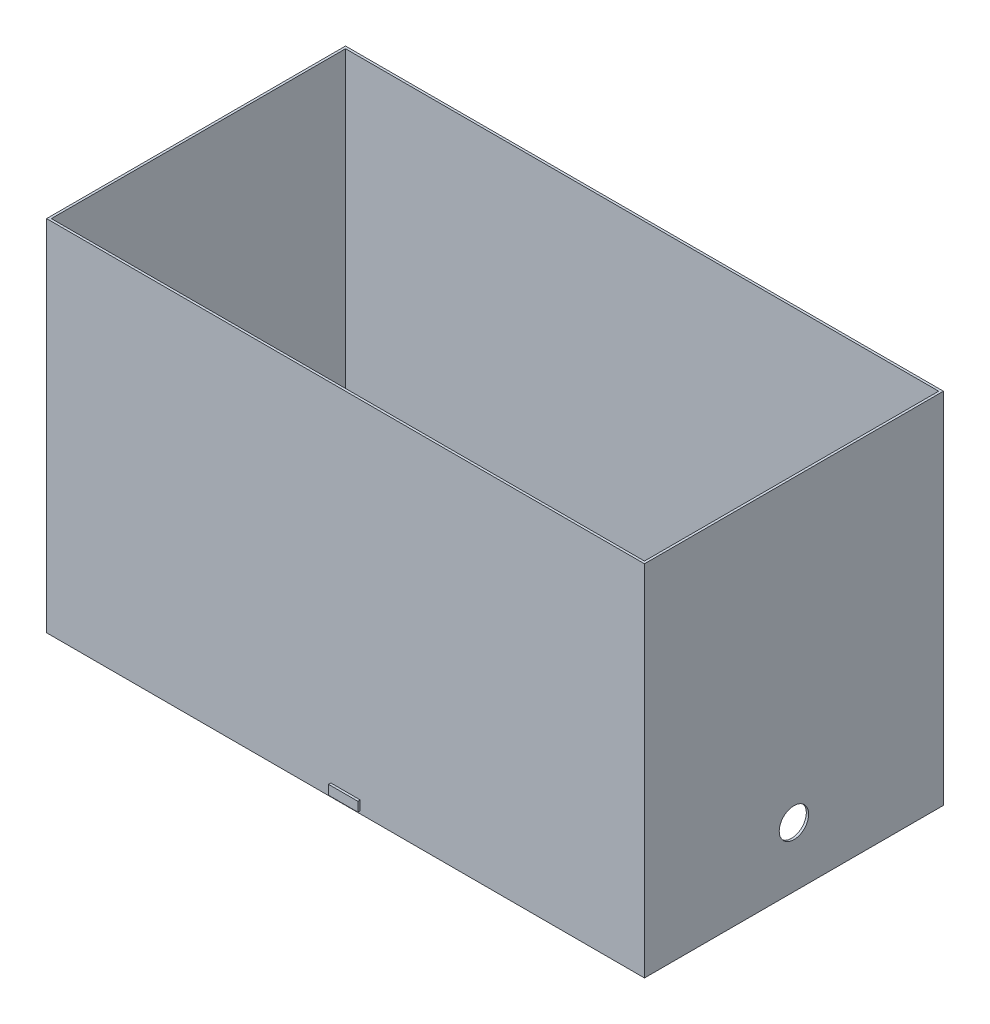
from build123d import *

# Parameters (mm, degrees)
SKETCH1_W           = 508
SKETCH1_H           = 254
SKETCH1_W_2         = 504
SKETCH1_H_2         = 250
BOSS_EXTRUDE1_DEPTH = 304.8
SKETCH2_R           = 12.5
CUT_EXTRUDE1_DEPTH  = 606.884510447
SKETCH3_W           = 25
SKETCH3_H           = 8
BOSS_EXTRUDE2_DEPTH = 2


with BuildPart() as part:
    # Sketch1 → Boss-Extrude1 (new body)
    with BuildSketch(Plane(origin=(0, 0, 0), x_dir=(1, 0, 0), z_dir=(0, 1, 0))):
        Rectangle(SKETCH1_W, SKETCH1_H)
        Rectangle(SKETCH1_W_2, SKETCH1_H_2, mode=Mode.SUBTRACT)
    extrude(amount=BOSS_EXTRUDE1_DEPTH)

    # Sketch2 → Cut-Extrude1 (cut, through all)
    with BuildSketch(Plane.ZY.offset(254)):
        with Locations((0, 50.8)):
            Circle(SKETCH2_R)
    extrude(amount=-CUT_EXTRUDE1_DEPTH, mode=Mode.SUBTRACT)

    # Sketch3 → Boss-Extrude2 (add)
    with BuildSketch(Plane.XY.offset(127)):
        with Locations((0, 6.27845753)):
            Rectangle(SKETCH3_W, SKETCH3_H)
    extrude(amount=BOSS_EXTRUDE2_DEPTH)


solid = part.part
